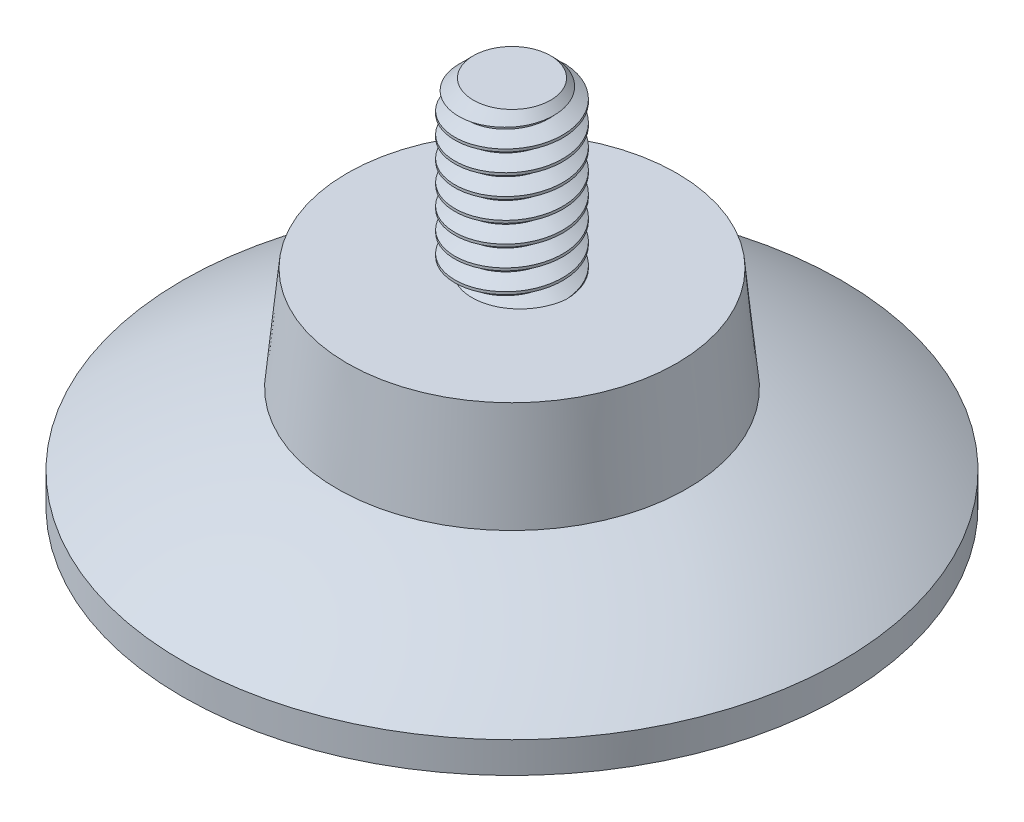
from build123d import *

# Parameters (mm, degrees)
SKETCH1_W        = 2.0828
SKETCH1_H        = 6.35
CHAMFER1_SIZE    = 0.5953125
CUT_SWEEP1_PITCH = 0.79375


with BuildPart() as part:
    # Sketch1 → Revolve1 (revolve)
    with BuildSketch(Plane.XY, mode=Mode.PRIVATE) as revolve1_sk:
        with Locations((1.0414, 11.1252)):
            Rectangle(SKETCH1_W, SKETCH1_H)
    revolve(revolve1_sk.sketch.rotate(Axis((0, 7.9502, 0), (0, 1, 0)), 90), axis=Axis((0, 7.9502, 0), (0, 1, 0)))

    # Chamfer1
    chamfer1_edges = [part.edges().sort_by_distance(p)[0] for p in [
        (0, 14.3002, 2.0828),
    ]]
    chamfer(chamfer1_edges, length=CHAMFER1_SIZE)

    # Cut-Sweep1: the profile of Sketch4 screwed along a right-hand helix of 9 turns, 8 arcs to a turn; built about Z, then put on its axis
    cut_sweep1_z = Axis((0, 0, 0), (0, 0, 1))
    cut_sweep1_corners = [(1.567244252, 0, -0.396875), (1.567244252, 0, -0.29765625), (2.1082, 0, 0.014664697), (2.1082, 0, -0.709195947)]
    with BuildLine(mode=Mode.PRIVATE) as cut_sweep1_profile:
        Line(cut_sweep1_corners[0], cut_sweep1_corners[1])
        Line(cut_sweep1_corners[1], cut_sweep1_corners[2])
        Line(cut_sweep1_corners[2], cut_sweep1_corners[3])
        Line(cut_sweep1_corners[3], cut_sweep1_corners[0])
    cut_sweep1_cap = Face(cut_sweep1_profile.wire())
    cut_sweep1_turn_angles = [0, 22.5, 45, 67.5, 90, 112.5, 135, 157.5, 180, 202.5, 225, 247.5, 270, 292.5, 315, 337.5, 360]
    cut_sweep1_turn_weights = [1, 0.9238795325112867, 1, 0.9238795325112867, 1, 0.9238795325112867, 1, 0.9238795325112867, 1, 0.9238795325112867, 1, 0.9238795325112867, 1, 0.9238795325112867, 1, 0.9238795325112867, 1]
    cut_sweep1_turn_rails = [Edge.make_bspline([Vector(p[0], p[1], 0).rotate(cut_sweep1_z, cut_sweep1_turn_angles[k]) / cut_sweep1_turn_weights[k] + Vector(0, 0, p[2] + CUT_SWEEP1_PITCH * cut_sweep1_turn_angles[k] / 360) for k in range(17)], [0, 0, 0, 1, 1, 2, 2, 3, 3, 4, 4, 5, 5, 6, 6, 7, 7, 8, 8, 8], 2, cut_sweep1_turn_weights) for p in cut_sweep1_corners]
    cut_sweep1_turn_sides = [Face.make_surface_from_curves(cut_sweep1_turn_rails[p[0]], cut_sweep1_turn_rails[p[1]]) for p in [(0, 1), (1, 2), (2, 3), (3, 0)]]
    cut_sweep1 = Plane(origin=(0, 14.3002, 0), x_dir=(1, 0, 0), z_dir=(0, -1, 0)) * Solid(Shell([*[p.moved(Location((0, 0, CUT_SWEEP1_PITCH * i))) for i in range(9) for p in cut_sweep1_turn_sides], cut_sweep1_cap, cut_sweep1_cap.rotate(cut_sweep1_z, 3240).moved(Location((0, 0, CUT_SWEEP1_PITCH * 3240 / 360)))]))
    add(cut_sweep1, mode=Mode.SUBTRACT)

    # Sketch5 → Revolve2 (revolve)
    with BuildSketch(Plane.XY, mode=Mode.PRIVATE) as revolve2_sk:
        with BuildLine():
            Line((0, 7.9502), (6.35, 7.9502))
            Line((6.35, 7.9502), (6.7437, 3.9624))
            ThreePointArc((6.7437, 3.9624), (9.819911095, 2.789066301), (12.7, 1.1938))
            Line((12.7, 1.1938), (12.7, 0))
            Line((12.7, 0), (11.5062, 0))
            ThreePointArc((11.5062, 0), (5.986556862, 2.466799663), (0, 3.311014018))
            Line((0, 3.311014018), (0, 7.9502))
        make_face()
    revolve(revolve2_sk.sketch.rotate(Axis((0, 0, 0), (0, 1, 0)), 90), axis=Axis((0, 0, 0), (0, 1, 0)))


solid = part.part
